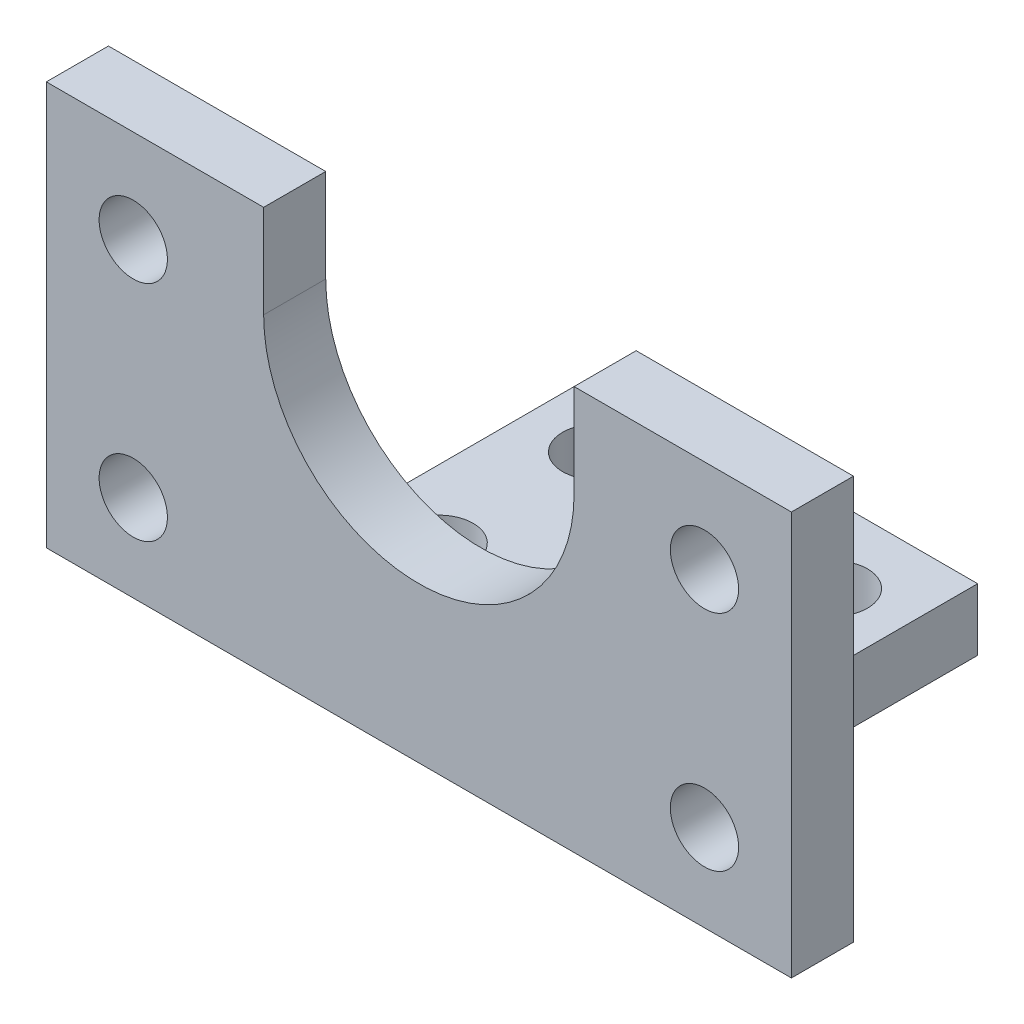
from build123d import *

# Parameters (mm, degrees)
SKETCH1_R           = 2.75
BOSS_EXTRUDE1_DEPTH = 5
SKETCH2_W           = 30
SKETCH2_H           = 30
SKETCH2_R           = 2.75
BOSS_EXTRUDE2_DEPTH = 5


with BuildPart() as part:
    # Sketch1 → Boss-Extrude1 (new body)
    with BuildSketch(Plane.XY):
        with BuildLine():
            Line((0, 32.5), (0, 0))
            Line((0, 0), (60, 0))
            Line((60, 0), (60, 32.5))
            Line((60, 32.5), (42.5, 32.5))
            Line((42.5, 32.5), (42.5, 25))
            ThreePointArc((42.5, 25), (30, 12.5), (17.5, 25))
            Line((17.5, 25), (17.5, 32.5))
            Line((17.5, 32.5), (0, 32.5))
        make_face()
        with Locations((7, 7)):
            Circle(SKETCH1_R, mode=Mode.SUBTRACT)
        with Locations((53, 7)):
            Circle(SKETCH1_R, mode=Mode.SUBTRACT)
        with Locations((7, 25)):
            Circle(SKETCH1_R, mode=Mode.SUBTRACT)
        with Locations((53, 25)):
            Circle(SKETCH1_R, mode=Mode.SUBTRACT)
    extrude(amount=BOSS_EXTRUDE1_DEPTH)

    # Sketch2 → Boss-Extrude2 (add)
    with BuildSketch(Plane.XZ):
        with Locations((30, -10)):
            Rectangle(SKETCH2_W, SKETCH2_H)
        with Locations((20.475, -6.15)):
            Circle(SKETCH2_R, mode=Mode.SUBTRACT)
        with Locations((39.525, -6.15)):
            Circle(SKETCH2_R, mode=Mode.SUBTRACT)
        with Locations((39.525, -18.85)):
            Circle(SKETCH2_R, mode=Mode.SUBTRACT)
        with Locations((20.475, -18.85)):
            Circle(SKETCH2_R, mode=Mode.SUBTRACT)
    extrude(amount=-BOSS_EXTRUDE2_DEPTH)


solid = part.part
